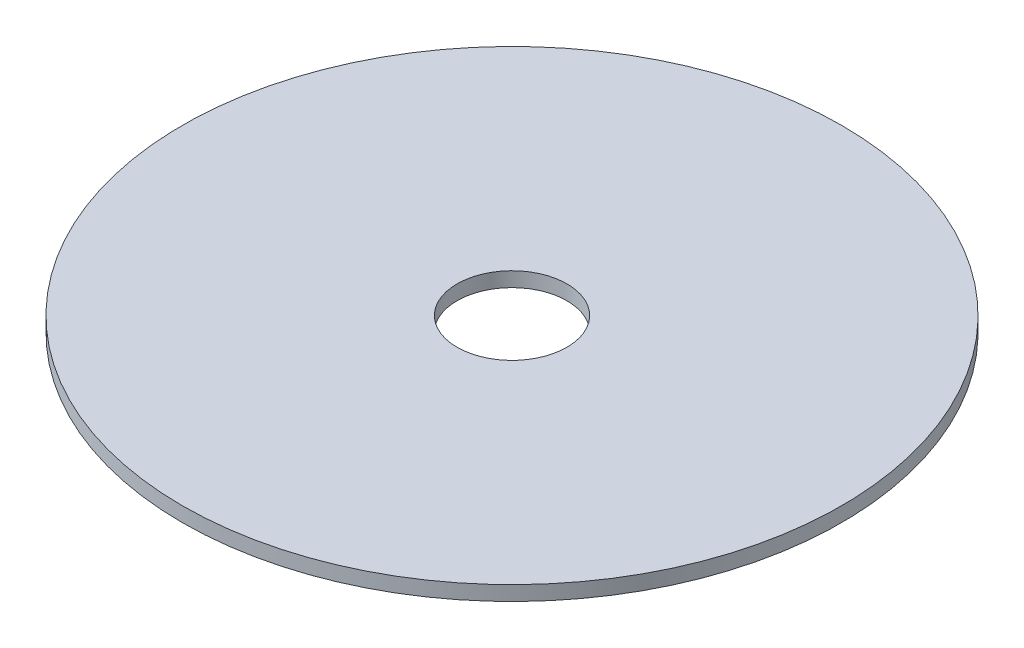
from build123d import *

# Parameters (mm, degrees)
SKETCH1_R           = 90
BOSS_EXTRUDE1_DEPTH = 4
SKETCH2_R           = 15
CUT_EXTRUDE1_DEPTH  = 128.342059038


with BuildPart() as part:
    # Sketch1 → Boss-Extrude1 (new body)
    with BuildSketch(Plane(origin=(0, 0, 0), x_dir=(1, 0, 0), z_dir=(0, 1, 0))):
        Circle(SKETCH1_R)
    extrude(amount=BOSS_EXTRUDE1_DEPTH)

    # Sketch2 → Cut-Extrude1 (cut, through all)
    with BuildSketch(Plane(origin=(0, 0, 0), x_dir=(1, 0, 0), z_dir=(0, 1, 0))):
        Circle(SKETCH2_R)
    extrude(amount=CUT_EXTRUDE1_DEPTH, mode=Mode.SUBTRACT)


solid = part.part
